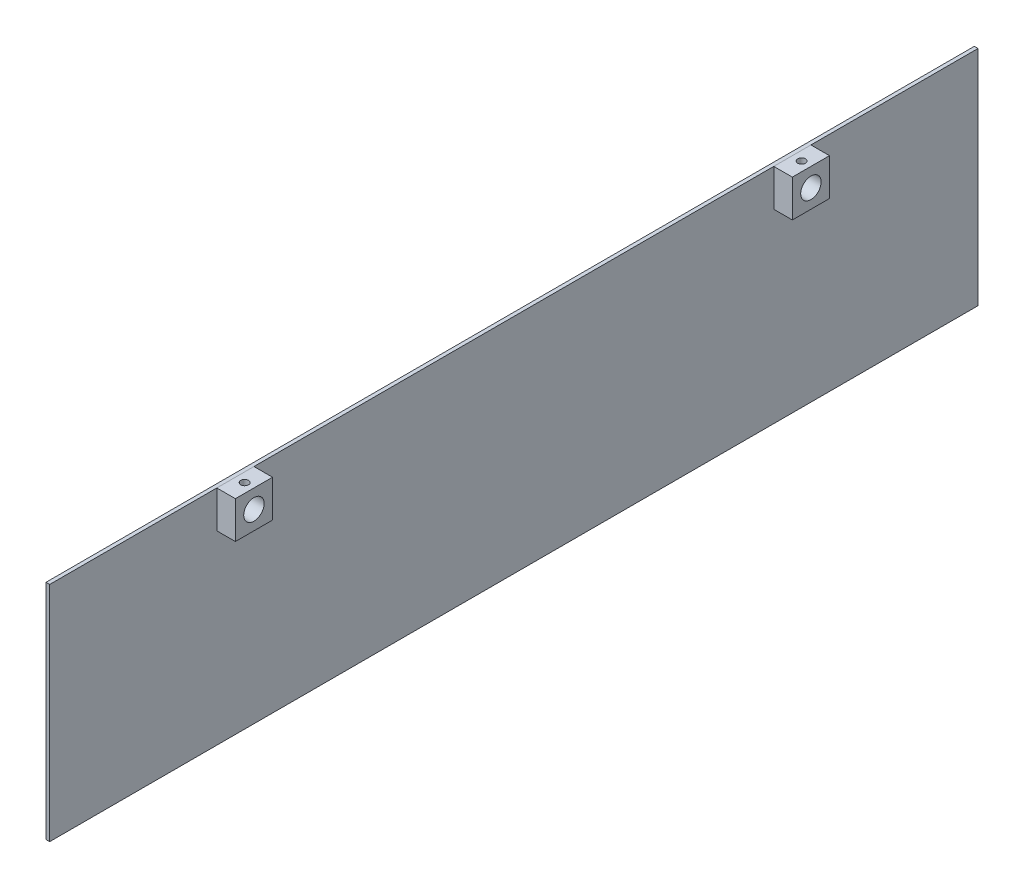
from build123d import *

# Parameters (mm, degrees)
SKIZZE1_W                                 = 2
SKIZZE1_H                                 = 120
BASIS_BLECH1_DEPTH                        = 250
SKIZZE6_W                                 = 20
SKIZZE6_H                                 = 20
AUFSATZ_LINEAR_AUSTRAGEN1_DEPTH           = 10
AUFSATZ_LINEAR_AUSTRAGEN1_2_DEPTH         = 10
F_11_0_11_DURCHMESSER_BOHRUNG1_AT_2_COUNT = 2
F_11_0_11_DURCHMESSER_BOHRUNG1_AT_2_PITCH = 300
M5_GEWINDEBOHRUNG1_AT_2_COUNT             = 2
M5_GEWINDEBOHRUNG1_AT_2_PITCH             = 300


# Sheet-metal steps are written as plain solids
with BuildPart() as part:
    # Skizze1 → Basis-Blech1 (new, symmetric)
    with BuildSketch(Plane.XY):
        with Locations((1, 60)):
            Rectangle(SKIZZE1_W, SKIZZE1_H)
    extrude(amount=BASIS_BLECH1_DEPTH, both=True)


with BuildPart() as body_2:
    # Skizze6 → Aufsatz-Linear austragen1 (new body)
    with BuildSketch(Plane(origin=(2, 0, 0), x_dir=(0, 0, -1), z_dir=(1, 0, 0))):
        with Locations((-150, 110)):
            Rectangle(SKIZZE6_W, SKIZZE6_H)
    extrude(amount=AUFSATZ_LINEAR_AUSTRAGEN1_DEPTH)


with BuildPart() as body_3:
    # Skizze6 → Aufsatz-Linear austragen1 2 (new body)
    with BuildSketch(Plane(origin=(2, 0, 0), x_dir=(0, 0, -1), z_dir=(1, 0, 0))):
        with Locations((150, 110)):
            Rectangle(SKIZZE6_W, SKIZZE6_H)
    extrude(amount=AUFSATZ_LINEAR_AUSTRAGEN1_2_DEPTH)


with BuildPart() as f_11_0_11_durchmesser_bohrung1_tool:
    # Skizze4 → Ø11.0 (11) Durchmesser Bohrung1 (revolve)
    with BuildSketch(Plane(origin=(0, 110, 150), x_dir=(0, 0, 1), z_dir=(0, 1, 0))):
        Polygon((0, 0), (0, 23.304733405), (5.5, 20), (5.5, 0), align=None)
    f_11_0_11_durchmesser_bohrung1 = revolve(axis=Axis((-6.35, 110, 150), (1, 0, 0)))


with BuildPart() as part_1:
    add(part.part)

    # Ø11.0 (11) Durchmesser Bohrung1: cut by f_11_0_11_durchmesser_bohrung1_tool
    add(f_11_0_11_durchmesser_bohrung1_tool.part, mode=Mode.SUBTRACT)


with BuildPart() as body_2_1:
    add(body_2.part)

    # Ø11.0 (11) Durchmesser Bohrung1: cut by f_11_0_11_durchmesser_bohrung1_tool
    add(f_11_0_11_durchmesser_bohrung1_tool.part, mode=Mode.SUBTRACT)

    # Skizze7 → M5 Gewindebohrung1 (revolve, cut)
    with BuildSketch(Plane(origin=(7, 120, 150), x_dir=(0, 0, 1), z_dir=(1, 0, 0))):
        Polygon((0, 0), (0, 15.2618073), (2.1, 14), (2.1, 0), align=None)
    m5_gewindebohrung1 = revolve(axis=Axis((7, 126.35, 150), (0, -1, 0)), mode=Mode.SUBTRACT)


with BuildPart() as f_11_0_11_durchmesser_bohrung1_at_2_tool:
    # Ø11.0 (11) Durchmesser Bohrung1 at 2: Ø11.0 (11) Durchmesser Bohrung1 ×2
    with Locations(*[(0, 0, -i * F_11_0_11_DURCHMESSER_BOHRUNG1_AT_2_PITCH) for i in range(1, F_11_0_11_DURCHMESSER_BOHRUNG1_AT_2_COUNT)]):
        add(f_11_0_11_durchmesser_bohrung1)


with BuildPart() as part_2:
    add(part_1.part)

    # Ø11.0 (11) Durchmesser Bohrung1 at 2: cut by f_11_0_11_durchmesser_bohrung1_at_2_tool
    add(f_11_0_11_durchmesser_bohrung1_at_2_tool.part, mode=Mode.SUBTRACT)


with BuildPart() as body_3_1:
    add(body_3.part)

    # Ø11.0 (11) Durchmesser Bohrung1 at 2: cut by f_11_0_11_durchmesser_bohrung1_at_2_tool
    add(f_11_0_11_durchmesser_bohrung1_at_2_tool.part, mode=Mode.SUBTRACT)

    # M5 Gewindebohrung1 at 2: M5 Gewindebohrung1 ×2
    with Locations(*[(0, 0, -i * M5_GEWINDEBOHRUNG1_AT_2_PITCH) for i in range(1, M5_GEWINDEBOHRUNG1_AT_2_COUNT)]):
        add(m5_gewindebohrung1, mode=Mode.SUBTRACT)


solid = Compound([body_2_1.part, part_2.part, body_3_1.part])
